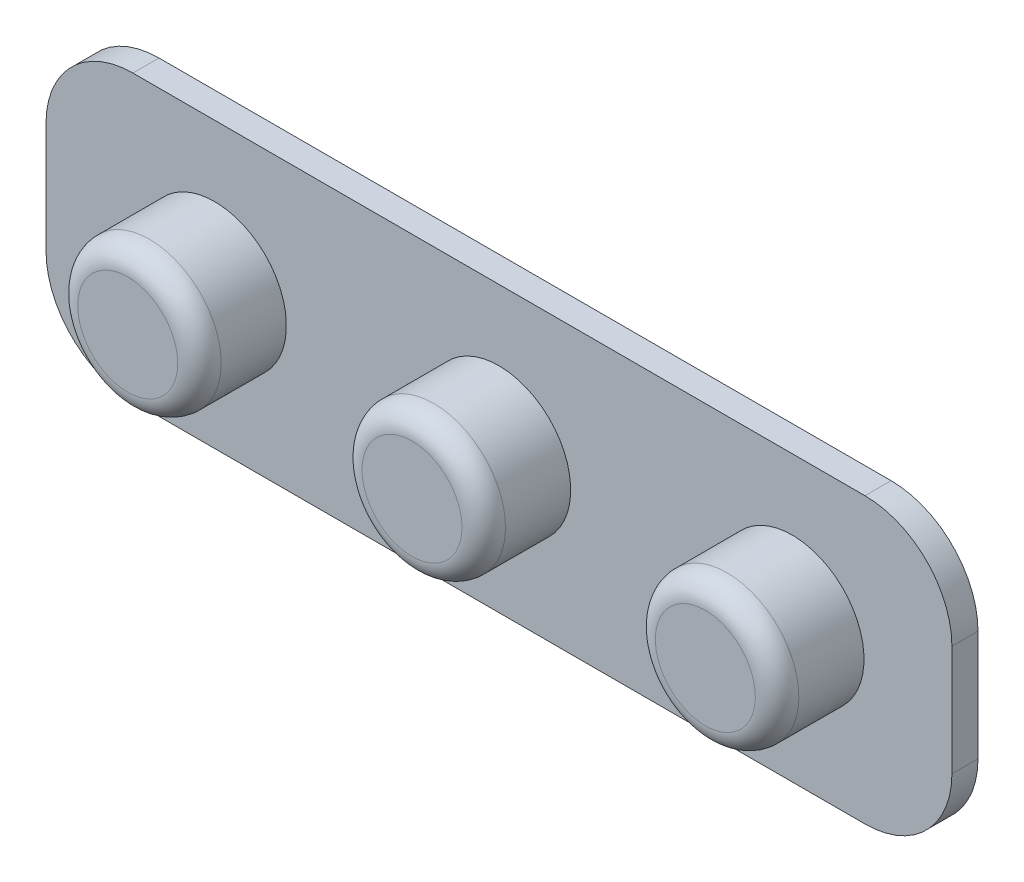
from build123d import *

# Parameters (mm, degrees)
SKETCH1_W           = 104.210537284
SKETCH1_H           = 32.703680443
BOSS_EXTRUDE1_DEPTH = 3
SKETCH1_3_R         = 8.25
BOSS_EXTRUDE2_DEPTH = 13
FILLET1_R           = 10
FILLET2_R           = 2.5


with BuildPart() as part:
    # Sketch1 → Boss-Extrude1 (new body)
    with BuildSketch(Plane.XY):
        with Locations((19.01225867, -3.633742272)):
            Rectangle(SKETCH1_W, SKETCH1_H)
    extrude(amount=BOSS_EXTRUDE1_DEPTH)

    # Sketch1<3> → Boss-Extrude2 (add)
    with BuildSketch(Plane.XY):
        with Locations((52.754151191, -3.633742271)):
            Circle(SKETCH1_3_R)
        with Locations((19.01225867, -3.633742271)):
            Circle(SKETCH1_3_R)
        with Locations((-13.691421773, -3.633742271)):
            Circle(SKETCH1_3_R)
    extrude(amount=BOSS_EXTRUDE2_DEPTH)

    # Fillet1
    fillet1_edges = [part.edges().sort_by_distance(p)[0] for p in [
        (71.117527312, 12.71809795, 1.5),
        (71.117527312, -19.985582493, 1.5),
        (-33.093009972, -19.985582493, 1.5),
        (-33.093009972, 12.71809795, 1.5),
    ]]
    fillet(fillet1_edges, radius=FILLET1_R)

    # Fillet2
    fillet2_edges = [part.edges().sort_by_distance(p)[0] for p in [
        (44.504151191, -3.633742271, 13),
        (10.76225867, -3.633742271, 13),
        (-21.941421773, -3.633742271, 13),
    ]]
    fillet(fillet2_edges, radius=FILLET2_R)


solid = part.part
